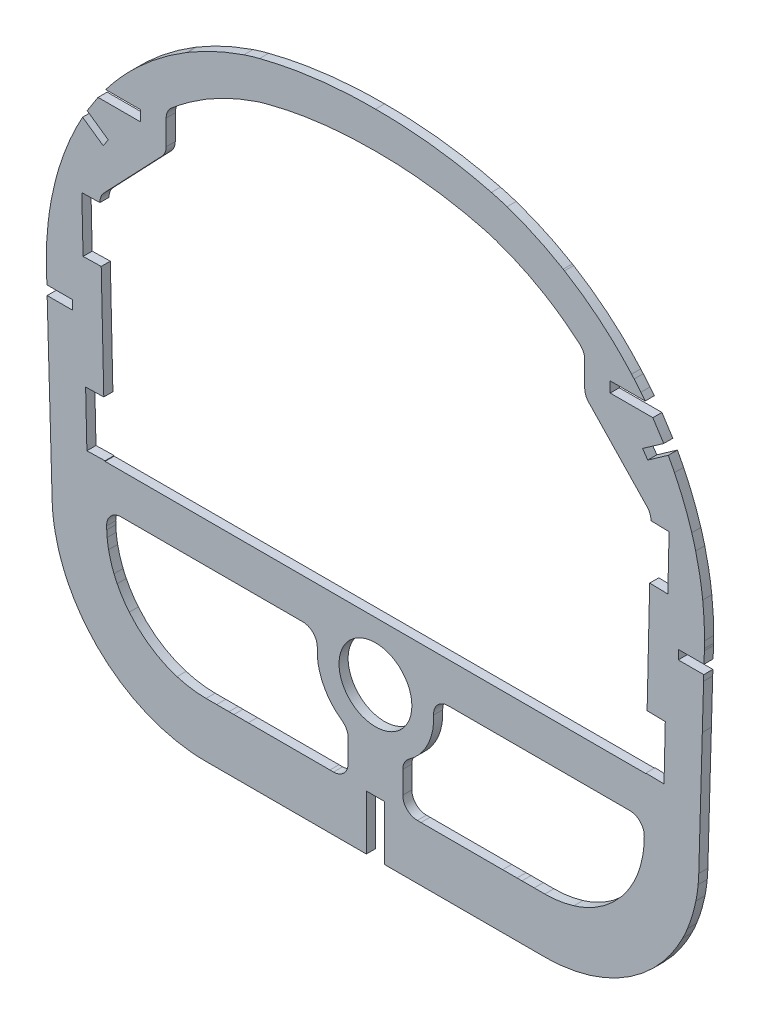
from build123d import *

# Parameters (mm, degrees)
SKETCH1_R           = 12.7
BOSS_EXTRUDE1_DEPTH = 1.5875
SKETCH2_R           = 20.32
CUT_EXTRUDE1_DEPTH  = 169.343867969
BOSS_EXTRUDE2_START = -3.175
BOSS_EXTRUDE2_DEPTH = 3.175
CUT_EXTRUDE3_DEPTH  = 169.343867969
BOSS_EXTRUDE3_START = -3.175
BOSS_EXTRUDE3_DEPTH = 3.175
FILLET1_R           = 5.08
CUT_EXTRUDE4_DEPTH  = 169.343867969


with BuildPart() as part:
    # Sketch1 → Boss-Extrude1 (new, symmetric)
    with BuildSketch(Plane.XY):
        with BuildLine():
            Line((-114.745219701, 17.50268352), (-114.725941099, 16.831990649))
            add(Edge.make_bspline(
                [(-114.725941099, 16.831990649), (-114.63641059, 13.717126836), (-114.546920366, 10.602259401), (-114.457477776, 7.487385265)],
                knots=[0, 0, 0, 0, 1, 1, 1, 1], degree=3, weights=[1, 1, 1, 1]))
            add(Edge.make_bspline(
                [(-114.457477776, 7.487385265), (-114.307187971, 2.253479662), (-114.157008662, -2.980453957), (-114.006996858, -8.214429234)],
                knots=[0, 0, 0, 0, 1, 1, 1, 1], degree=3, weights=[1, 1, 1, 1]))
            add(Edge.make_bspline(
                [(-114.006996858, -8.214429234), (-113.594092008, -22.620853681), (-113.18138691, -37.027683807), (-112.768745153, -51.434848977)],
                knots=[0, 0, 0, 0, 1, 1, 1, 1], degree=3, weights=[1, 1, 1, 1]))
            ThreePointArc((-112.768745153, -51.434848977), (-112.688043339, -53.175933137), (-112.55087679, -54.913480884))
            ThreePointArc((-112.55087679, -54.913480884), (-112.227978646, -57.588783935), (-111.771284771, -60.244521183))
            add(Edge.make_bspline(
                [(-111.771284771, -60.244521183), (-111.107373315, -63.598835082), (-110.122064493, -66.88944897), (-108.833223909, -70.05665448)],
                knots=[0, 0, 0, 0, 1, 1, 1, 1], degree=3, weights=[1, 1, 1, 1]))
            ThreePointArc((-108.833223909, -70.05665448), (-108.013564938, -71.964354711), (-107.120761168, -73.838937979))
            add(Edge.make_bspline(
                [(-107.120761168, -73.838937979), (-105.328832545, -77.42121555), (-103.134418824, -80.802035178), (-100.591921024, -83.897282027)],
                knots=[0, 0, 0, 0, 1, 1, 1, 1], degree=3, weights=[1, 1, 1, 1]))
            add(Edge.make_bspline(
                [(-100.591921024, -83.897282027), (-95.592425272, -89.983687859), (-89.401020105, -95.094032548), (-82.316654238, -98.869984949), (-74.78459325, -101.171976909)],
                knots=[0, 0, 0, 0, 0, 1, 1, 1, 1, 1], degree=4, weights=[1, 1, 1, 1, 1]))
            add(Edge.make_bspline(
                [(-74.78459325, -101.171976909), (-69.703753143, -102.724812597), (-64.391583826, -103.518123272), (-59.078900914, -103.51750007)],
                knots=[0, 0, 0, 0, 1, 1, 1, 1], degree=3, weights=[1, 1, 1, 1]))
            add(Edge.make_bspline(
                [(-59.078900914, -103.51750007), (-57.846433259, -103.517355498), (-56.613975306, -103.517238266), (-55.381524485, -103.517145846)],
                knots=[0, 0, 0, 0, 1, 1, 1, 1], degree=3, weights=[1, 1, 1, 1]))
            add(Edge.make_bspline(
                [(-55.381524485, -103.517145846), (-53.957166715, -103.517039039), (-52.532819232, -103.516967998), (-51.108477772, -103.516935673)],
                knots=[0, 0, 0, 0, 1, 1, 1, 1], degree=3, weights=[1, 1, 1, 1]))
            Line((-51.108477772, -103.516935673), (-49.378600467, -103.516915467))
            add(Edge.make_bspline(
                [(-49.378600467, -103.516915467), (-47.710160695, -103.51691463), (-46.041727647, -103.516961831), (-44.373293701, -103.517077629)],
                knots=[0, 0, 0, 0, 1, 1, 1, 1], degree=3, weights=[1, 1, 1, 1]))
            add(Edge.make_bspline(
                [(-44.373293701, -103.517077629), (-29.582422277, -103.51810416), (-14.791380965, -103.519626445), (-2e-09, -103.521672386)],
                knots=[0, 0, 0, 0, 1, 1, 1, 1], degree=3, weights=[1, 1, 1, 1]))
            add(Edge.make_bspline(
                [(44.373293701, -103.517077629), (29.582422277, -103.51810416), (14.791380965, -103.519626445), (-2e-09, -103.521672386)],
                knots=[0, 0, 0, 0, 1, 1, 1, 1], degree=3, weights=[1, 1, 1, 1]))
            add(Edge.make_bspline(
                [(49.378600467, -103.516915467), (47.710160695, -103.51691463), (46.041727647, -103.516961831), (44.373293701, -103.517077629)],
                knots=[0, 0, 0, 0, 1, 1, 1, 1], degree=3, weights=[1, 1, 1, 1]))
            Line((49.378600467, -103.516915467), (51.108477772, -103.516935673))
            add(Edge.make_bspline(
                [(55.381524485, -103.517145846), (53.957166715, -103.517039039), (52.532819232, -103.516967998), (51.108477772, -103.516935673)],
                knots=[0, 0, 0, 0, 1, 1, 1, 1], degree=3, weights=[1, 1, 1, 1]))
            add(Edge.make_bspline(
                [(59.078900914, -103.51750007), (57.846433259, -103.517355498), (56.613975306, -103.517238266), (55.381524485, -103.517145846)],
                knots=[0, 0, 0, 0, 1, 1, 1, 1], degree=3, weights=[1, 1, 1, 1]))
            add(Edge.make_bspline(
                [(74.78459325, -101.171976909), (69.703753143, -102.724812597), (64.391583826, -103.518123272), (59.078900914, -103.51750007)],
                knots=[0, 0, 0, 0, 1, 1, 1, 1], degree=3, weights=[1, 1, 1, 1]))
            add(Edge.make_bspline(
                [(100.591921024, -83.897282027), (95.592425272, -89.983687859), (89.401020105, -95.094032548), (82.316654238, -98.869984949), (74.78459325, -101.171976909)],
                knots=[0, 0, 0, 0, 0, 1, 1, 1, 1, 1], degree=4, weights=[1, 1, 1, 1, 1]))
            add(Edge.make_bspline(
                [(107.120761168, -73.838937979), (105.328832545, -77.42121555), (103.134418824, -80.802035178), (100.591921024, -83.897282027)],
                knots=[0, 0, 0, 0, 1, 1, 1, 1], degree=3, weights=[1, 1, 1, 1]))
            ThreePointArc((107.120761168, -73.838937979), (108.013564938, -71.964354711), (108.833223909, -70.05665448))
            add(Edge.make_bspline(
                [(111.771284771, -60.244521183), (111.107373315, -63.598835082), (110.122064493, -66.88944897), (108.833223909, -70.05665448)],
                knots=[0, 0, 0, 0, 1, 1, 1, 1], degree=3, weights=[1, 1, 1, 1]))
            ThreePointArc((111.771284771, -60.244521183), (112.227978646, -57.588783935), (112.55087679, -54.913480884))
            ThreePointArc((112.55087679, -54.913480884), (112.688043339, -53.175933137), (112.768745153, -51.434848977))
            add(Edge.make_bspline(
                [(114.006996858, -8.214429234), (113.594092008, -22.620853681), (113.18138691, -37.027683807), (112.768745153, -51.434848977)],
                knots=[0, 0, 0, 0, 1, 1, 1, 1], degree=3, weights=[1, 1, 1, 1]))
            add(Edge.make_bspline(
                [(114.457477776, 7.487385265), (114.307187971, 2.253479662), (114.157008662, -2.980453957), (114.006996858, -8.214429234)],
                knots=[0, 0, 0, 0, 1, 1, 1, 1], degree=3, weights=[1, 1, 1, 1]))
            add(Edge.make_bspline(
                [(114.725941099, 16.831990649), (114.63641059, 13.717126836), (114.546920366, 10.602259401), (114.457477776, 7.487385265)],
                knots=[0, 0, 0, 0, 1, 1, 1, 1], degree=3, weights=[1, 1, 1, 1]))
            Line((114.725941099, 16.831990649), (114.745219701, 17.50268352))
            add(Edge.make_bspline(
                [(114.789005912, 19.863219177), (114.783578069, 19.076239432), (114.767832082, 18.289356898), (114.745219701, 17.50268352)],
                knots=[0, 0, 0, 0, 0.999949851, 0.999949851, 0.999949851, 0.999949851], degree=3, weights=[1, 1, 1, 1]))
            add(Edge.make_bspline(
                [(114.158943276, 31.865695052), (114.606138459, 27.882027972), (114.816653441, 23.871808144), (114.789005912, 19.863219177)],
                knots=[0, 0, 0, 0, 1, 1, 1, 1], degree=3, weights=[1, 1, 1, 1]))
            add(Edge.make_bspline(
                [(111.684573503, 45.461033638), (112.817340494, 40.992572367), (113.644690454, 36.446719505), (114.158943276, 31.865695052)],
                knots=[0, 0, 0, 0, 1, 1, 1, 1], degree=3, weights=[1, 1, 1, 1]))
            ThreePointArc((111.684573503, 45.461033638), (111.039061352, 47.881394375), (110.333919599, 50.28505973))
            add(Edge.make_bspline(
                [(104.306410252, 65.447751106), (106.718862852, 60.566499961), (108.736743892, 55.490368749), (110.333919599, 50.28505973)],
                knots=[0, 0, 0, 0, 1, 1, 1, 1], degree=3, weights=[1, 1, 1, 1]))
            add(Edge.make_bspline(
                [(92.591503427, 83.848852612), (97.14327095, 78.160171497), (101.078545041, 71.978872592), (104.306410252, 65.447751106)],
                knots=[0.000155167, 0.000155167, 0.000155167, 0.000155167, 1, 1, 1, 1], degree=3, weights=[1, 1, 1, 1]))
            ThreePointArc((92.591503427, 83.848852612), (91.425078169, 85.279695716), (90.232771029, 86.689044343))
            ThreePointArc((90.232771029, 86.689044343), (89.792232132, 87.196837869), (89.348332197, 87.701695902))
            add(Edge.make_bspline(
                [(65.944329998, 107.226814859), (74.668891481, 101.945417302), (82.588941753, 95.338030018), (89.348332197, 87.701695902)],
                knots=[0, 0, 0, 0, 1, 1, 1, 1], degree=3, weights=[1, 1, 1, 1]))
            Line((65.944329998, 107.226814859), (65.496240856, 107.496486164))
            add(Edge.make_bspline(
                [(45.895792553, 116.544518586), (52.726322536, 114.237124464), (59.30942518, 111.198133381), (65.496240856, 107.496486164)],
                knots=[0, 0, 0, 0, 1, 1, 1, 1], degree=3, weights=[1, 1, 1, 1]))
            ThreePointArc((45.895792553, 116.544518586), (43.177996547, 117.403166162), (40.428399029, 118.153768767))
            add(Edge.make_bspline(
                [(40.428399029, 118.153768767), (39.338061837, 118.428387587), (37.157463208, 118.977606147), (33.856301535, 119.70948989), (30.535885824, 120.37426224), (27.195829245, 120.965490945), (23.83863112, 121.485095365), (20.46591669, 121.932693658), (17.079460249, 122.308500946), (13.680927413, 122.612357423), (10.271955071, 122.844687918), (6.854161077, 123.003605665), (3.429096592, 123.095526457), (1.143477199, 123.095526457), (-2e-09, 123.095526457)],
                knots=[0, 0, 0, 0, 0.083199823, 0.166393866, 0.249589221, 0.33279405, 0.416017442, 0.499269274, 0.582560092, 0.665900987, 0.749303484, 0.832779429, 0.916340878, 1, 1, 1, 1], degree=3))
            add(Edge.make_bspline(
                [(-40.428399029, 118.153768767), (-39.338061838, 118.428387587), (-37.157463209, 118.977606147), (-33.856301535, 119.70948989), (-30.535885825, 120.374262239), (-27.195829246, 120.965490945), (-23.838631121, 121.485095365), (-20.465916692, 121.932693658), (-17.079460251, 122.308500946), (-13.680927416, 122.612357423), (-10.271955073, 122.844687918), (-6.854161079, 123.003605665), (-3.429096594, 123.095526457), (-1.143477203, 123.095526457), (-2e-09, 123.095526457)],
                knots=[0, 0, 0, 0, 0.083199823, 0.166393866, 0.249589221, 0.33279405, 0.416017442, 0.499269274, 0.582560092, 0.665900987, 0.749303484, 0.832779429, 0.916340878, 1, 1, 1, 1], degree=3))
            ThreePointArc((-40.428399029, 118.153768767), (-43.177996547, 117.403166162), (-45.895792553, 116.544518586))
            add(Edge.make_bspline(
                [(-45.895792553, 116.544518586), (-52.726322536, 114.237124464), (-59.30942518, 111.198133381), (-65.496240856, 107.496486164)],
                knots=[0, 0, 0, 0, 1, 1, 1, 1], degree=3, weights=[1, 1, 1, 1]))
            Line((-65.496240856, 107.496486164), (-65.944329998, 107.226814859))
            add(Edge.make_bspline(
                [(-65.944329998, 107.226814859), (-74.668891481, 101.945417302), (-82.588941753, 95.338030018), (-89.348332197, 87.701695902)],
                knots=[0, 0, 0, 0, 1, 1, 1, 1], degree=3, weights=[1, 1, 1, 1]))
            ThreePointArc((-89.348332197, 87.701695902), (-89.792232132, 87.196837869), (-90.232771029, 86.689044343))
            ThreePointArc((-90.232771029, 86.689044343), (-91.425078169, 85.279695716), (-92.591503427, 83.848852612))
            add(Edge.make_bspline(
                [(-92.591503427, 83.848852612), (-97.14327095, 78.160171497), (-101.078545041, 71.978872592), (-104.306410252, 65.447751106)],
                knots=[0.000155167, 0.000155167, 0.000155167, 0.000155167, 1, 1, 1, 1], degree=3, weights=[1, 1, 1, 1]))
            add(Edge.make_bspline(
                [(-104.306410252, 65.447751106), (-106.718862852, 60.566499961), (-108.736743892, 55.490368749), (-110.333919599, 50.28505973)],
                knots=[0, 0, 0, 0, 1, 1, 1, 1], degree=3, weights=[1, 1, 1, 1]))
            ThreePointArc((-110.333919599, 50.28505973), (-111.039061352, 47.881394375), (-111.684573503, 45.461033638))
            add(Edge.make_bspline(
                [(-111.684573503, 45.461033638), (-112.817340494, 40.992572367), (-113.644690454, 36.446719505), (-114.158943276, 31.865695052)],
                knots=[0, 0, 0, 0, 1, 1, 1, 1], degree=3, weights=[1, 1, 1, 1]))
            add(Edge.make_bspline(
                [(-114.158943276, 31.865695052), (-114.606138459, 27.882027972), (-114.816653441, 23.871808144), (-114.789005912, 19.863219177)],
                knots=[0, 0, 0, 0, 1, 1, 1, 1], degree=3, weights=[1, 1, 1, 1]))
            add(Edge.make_bspline(
                [(-114.789005912, 19.863219177), (-114.783578069, 19.076239432), (-114.767832082, 18.289356898), (-114.745219701, 17.50268352)],
                knots=[0, 0, 0, 0, 0.999949851, 0.999949851, 0.999949851, 0.999949851], degree=3, weights=[1, 1, 1, 1]))
        make_face()
        with Locations((0, -50.8)):
            Circle(SKETCH1_R, mode=Mode.SUBTRACT)
    extrude(amount=BOSS_EXTRUDE1_DEPTH, both=True)

    # Sketch2 → Cut-Extrude1 (cut, through all)
    with BuildSketch(Plane.XY.offset(1.5875)):
        with BuildLine():
            Line((-102.050463045, 17.867585499), (-102.031184204, 17.196884294))
            add(Edge.make_bspline(
                [(-102.031184204, 17.196884294), (-102.008800746, 16.418139435), (-101.96403891, 14.860650808), (-101.896911773, 12.524410001), (-101.829801051, 10.188164784), (-101.785071893, 8.630662089), (-101.762710321, 7.85191135)],
                knots=[-8.91e-07, -8.91e-07, -8.91e-07, -8.91e-07, 0.249999332, 0.499999554, 0.749999777, 1, 1, 1, 1], degree=3))
            add(Edge.make_bspline(
                [(-101.762710321, 7.85191135), (-101.725136444, 6.543385291), (-101.650002801, 3.92634007), (-101.537348227, 0.000729396), (-101.424745489, -3.924904493), (-101.349714688, -6.54202509), (-101.312209931, -7.850581912)],
                knots=[0, 0, 0, 0, 0.25, 0.5, 0.75, 1, 1, 1, 1], degree=3))
            add(Edge.make_bspline(
                [(-101.312209931, -7.850581912), (-101.209005728, -11.451420096), (-101.002624636, -18.65306494), (-100.693113652, -29.455727912), (-100.383653292, -40.258483963), (-100.177369952, -47.460437031), (-100.074233248, -51.061399329)],
                knots=[0, 0, 0, 0, 0.249943011, 0.499886022, 0.749829033, 0.999772044, 0.999772044, 0.999772044, 0.999772044], degree=3))
            ThreePointArc((-100.074233248, -51.061399329), (-100.012611827, -52.386338416), (-99.908161909, -53.708590659))
            ThreePointArc((-99.908161909, -53.708590659), (-99.661632916, -55.751134621), (-99.312957114, -57.778740984))
            add(Edge.make_bspline(
                [(-99.312957114, -57.778740984), (-99.186298208, -58.418660842), (-98.902364609, -59.692255532), (-98.385225857, -61.582274016), (-97.778532025, -63.445475331), (-97.315789282, -64.665524335), (-97.069912529, -65.269744686)],
                knots=[8.435e-06, 8.435e-06, 8.435e-06, 8.435e-06, 0.250005448, 0.500002461, 0.749999475, 0.999996488, 0.999996488, 0.999996488, 0.999996488], degree=3))
            ThreePointArc((-97.069912529, -65.269744686), (-96.444138483, -66.726189812), (-95.762522673, -68.157352083))
            add(Edge.make_bspline(
                [(-95.762522673, -68.157352083), (-95.420721884, -68.840650935), (-94.698870817, -70.187794284), (-93.503074088, -72.147852648), (-92.199695974, -74.038052913), (-91.263189017, -75.245782616), (-90.778256541, -75.836141324)],
                knots=[3.677e-06, 3.677e-06, 3.677e-06, 3.677e-06, 0.250002758, 0.500001839, 0.750000919, 1, 1, 1, 1], degree=3))
            add(Edge.make_bspline(
                [(-90.778256541, -75.836141324), (-89.5068667, -77.383936328), (-86.732462047, -80.297419908), (-81.98109245, -84.008900731), (-76.738822768, -86.986824087), (-72.988073791, -88.441143727), (-71.07263786, -89.026550314)],
                knots=[0, 0, 0, 0, 0.25, 0.5, 0.75, 1, 1, 1, 1], degree=3))
            add(Edge.make_bspline(
                [(-71.07263786, -89.026550314), (-70.103821767, -89.322645482), (-68.144734069, -89.842285315), (-65.148404864, -90.403750907), (-62.118788467, -90.742207047), (-60.093419884, -90.817618991), (-59.080390681, -90.817500158)],
                knots=[0, 0, 0, 0, 0.25, 0.5, 0.75, 1, 1, 1, 1], degree=3))
            add(Edge.make_bspline(
                [(-59.080390681, -90.817500158), (-58.772227934, -90.817464009), (-58.155900801, -90.81739513), (-57.231420128, -90.817301829), (-56.306944263, -90.817218308), (-55.690633155, -90.81716899), (-55.382476834, -90.817145882)],
                knots=[0, 0, 0, 0, 0.25, 0.5, 0.75, 1, 1, 1, 1], degree=3))
            add(Edge.make_bspline(
                [(-55.382476834, -90.817145882), (-55.026328468, -90.817119176), (-54.314031712, -90.817070235), (-53.24558692, -90.817010514), (-52.17714195, -90.816964762), (-51.46484463, -90.816943757), (-51.108696054, -90.816935675)],
                knots=[0, 0, 0, 0, 0.250004092, 0.500008184, 0.750012275, 1.000016367, 1.000016367, 1.000016367, 1.000016367], degree=3))
            Line((-51.108696054, -90.816935675), (-49.378677826, -90.816915467))
            add(Edge.make_bspline(
                [(-49.378677826, -90.816915467), (-48.961498146, -90.816915257), (-48.127143203, -90.816920843), (-46.875584291, -90.816949169), (-45.624011532, -90.816999369), (-44.789610407, -90.817048704), (-44.372412255, -90.81707766)],
                knots=[-1.4182e-05, -1.4182e-05, -1.4182e-05, -1.4182e-05, 0.249989363, 0.499992909, 0.749996454, 1, 1, 1, 1], degree=3))
            add(Edge.make_bspline(
                [(-44.372412255, -90.81707766), (-40.674757865, -90.817334288), (-33.581755225, -90.817885995), (-24.639838712, -90.818727254), (-17.244432866, -90.819513267), (-9.546700394, -90.820403554), (-3.697752931, -90.821160802), (0, -90.821672264)],
                knots=[0, 0, 0, 0, 0.249990103, 0.479543267, 0.604538319, 0.74997031, 0.999960413, 0.999960413, 0.999960413, 0.999960413], degree=3))
            add(Edge.make_bspline(
                [(0, -90.821672264), (3.697752931, -90.821160802), (9.546700394, -90.820403554), (17.244432866, -90.819513267), (24.639838712, -90.818727254), (33.581755225, -90.817885995), (40.674757865, -90.817334288), (44.372412284, -90.81707766)],
                knots=[3.9587e-05, 3.9587e-05, 3.9587e-05, 3.9587e-05, 0.25002969, 0.395461681, 0.520456733, 0.750009897, 1, 1, 1, 1], degree=3))
            add(Edge.make_bspline(
                [(44.372412284, -90.81707766), (44.789610407, -90.817048704), (45.624011532, -90.816999369), (46.87558429, -90.816949169), (48.127143202, -90.816920843), (48.961498145, -90.816915257), (49.378677825, -90.816915467)],
                knots=[0, 0, 0, 0, 0.250003546, 0.500007091, 0.750010637, 1.000014182, 1.000014182, 1.000014182, 1.000014182], degree=3))
            Line((49.378677825, -90.816915467), (51.108696054, -90.816935675))
            add(Edge.make_bspline(
                [(51.108696054, -90.816935675), (51.46484463, -90.816943757), (52.17714195, -90.816964762), (53.24558692, -90.817010514), (54.314031712, -90.817070235), (55.026328468, -90.817119176), (55.382476817, -90.817145882)],
                knots=[-1.6367e-05, -1.6367e-05, -1.6367e-05, -1.6367e-05, 0.249987725, 0.499991816, 0.749995908, 1, 1, 1, 1], degree=3))
            add(Edge.make_bspline(
                [(55.382476817, -90.817145882), (55.690633155, -90.81716899), (56.306944263, -90.817218308), (57.231420128, -90.817301829), (58.155900801, -90.81739513), (58.772227934, -90.817464009), (59.080390665, -90.817500158)],
                knots=[0, 0, 0, 0, 0.25, 0.5, 0.75, 1, 1, 1, 1], degree=3))
            add(Edge.make_bspline(
                [(59.080390665, -90.817500158), (60.093419884, -90.817618991), (62.118788467, -90.742207047), (65.148404864, -90.403750907), (68.144734069, -89.842285315), (70.103821767, -89.322645482), (71.072637852, -89.026550316)],
                knots=[0, 0, 0, 0, 0.25, 0.5, 0.75, 1, 1, 1, 1], degree=3))
            add(Edge.make_bspline(
                [(71.072637852, -89.026550316), (72.988073791, -88.441143727), (76.738822768, -86.986824087), (81.98109245, -84.008900731), (86.732462047, -80.297419908), (89.5068667, -77.383936328), (90.778256549, -75.836141315)],
                knots=[0, 0, 0, 0, 0.25, 0.5, 0.75, 1, 1, 1, 1], degree=3))
            add(Edge.make_bspline(
                [(90.778256549, -75.836141315), (91.263189017, -75.245782616), (92.199695973, -74.038052914), (93.503074088, -72.147852649), (94.698870816, -70.187794286), (95.420721883, -68.840650937), (95.762522672, -68.157352085)],
                knots=[0, 0, 0, 0, 0.249999081, 0.499998161, 0.749997242, 0.999996323, 0.999996323, 0.999996323, 0.999996323], degree=3))
            ThreePointArc((95.762522672, -68.157352085), (96.444138483, -66.726189813), (97.069912528, -65.269744687))
            add(Edge.make_bspline(
                [(97.069912528, -65.269744687), (97.315789266, -64.665524375), (97.778531982, -63.445475449), (98.385225784, -61.582274255), (98.902364517, -59.692255895), (99.186298111, -58.418661289), (99.312957017, -57.778741474)],
                knots=[3.512e-06, 3.512e-06, 3.512e-06, 3.512e-06, 0.250000509, 0.499997507, 0.749994504, 0.999991501, 0.999991501, 0.999991501, 0.999991501], degree=3))
            ThreePointArc((99.312957017, -57.778741474), (99.661632939, -55.751134468), (99.908161986, -53.708589855))
            ThreePointArc((99.908161986, -53.708589855), (100.012611852, -52.386338014), (100.074233248, -51.061399334))
            add(Edge.make_bspline(
                [(100.074233248, -51.061399334), (100.177369952, -47.460437035), (100.383653292, -40.258483966), (100.693113652, -29.455727914), (101.002624636, -18.653064941), (101.209005728, -11.451420096), (101.312209932, -7.850581901)],
                knots=[0.000227956, 0.000227956, 0.000227956, 0.000227956, 0.250170967, 0.500113978, 0.750056989, 1, 1, 1, 1], degree=3))
            add(Edge.make_bspline(
                [(101.312209932, -7.850581901), (101.349714688, -6.54202509), (101.424745489, -3.924904493), (101.537348227, 0.000729396), (101.650002801, 3.92634007), (101.725136444, 6.543385291), (101.762710316, 7.851911159)],
                knots=[0, 0, 0, 0, 0.25, 0.5, 0.75, 1, 1, 1, 1], degree=3))
            add(Edge.make_bspline(
                [(101.762710316, 7.851911159), (101.785071893, 8.630662089), (101.829801051, 10.188164784), (101.896911773, 12.524410001), (101.96403891, 14.860650808), (102.008800746, 16.418139435), (102.031184204, 17.196884294)],
                knots=[0, 0, 0, 0, 0.250000223, 0.500000446, 0.750000668, 1.000000891, 1.000000891, 1.000000891, 1.000000891], degree=3))
            Line((102.031184204, 17.196884294), (102.050463045, 17.867585499))
            add(Edge.make_bspline(
                [(102.050463045, 17.867585499), (102.055551985, 18.044627171), (102.065000889, 18.400471802), (102.076319054, 18.92387062), (102.084692043, 19.442100282), (102.08813442, 19.780657865), (102.089307966, 19.950809687)],
                knots=[0, 0, 0, 0, 0.249987463, 0.499974925, 0.749962388, 0.999949851, 0.999949851, 0.999949851, 0.999949851], degree=3))
            add(Edge.make_bspline(
                [(102.089307966, 19.950809687), (102.095352924, 20.827262326), (102.081407299, 22.580361419), (101.982484379, 25.208721183), (101.805673274, 27.832993935), (101.63599196, 29.577923303), (101.538215451, 30.448927892)],
                knots=[0, 0, 0, 0, 0.25, 0.5, 0.75, 1, 1, 1, 1], degree=3))
            add(Edge.make_bspline(
                [(101.538215451, 30.448927892), (101.425780929, 31.450507804), (101.166683011, 33.449848276), (100.675866954, 36.43458947), (100.083590763, 39.400865014), (99.621642689, 41.363287328), (99.3739787, 42.340255594)],
                knots=[0, 0, 0, 0, 0.249999819, 0.499999638, 0.749999457, 0.999999276, 0.999999276, 0.999999276, 0.999999276], degree=3))
            ThreePointArc((99.3739787, 42.340255594), (98.809370853, 44.457263785), (98.192607267, 46.559669165))
            add(Edge.make_bspline(
                [(98.192607267, 46.559669165), (97.843455662, 47.697579033), (97.09915666, 49.959324861), (95.846474919, 53.305339769), (94.460053728, 56.598199577), (93.448399334, 58.753696156), (92.92102149, 59.820769434)],
                knots=[0, 0, 0, 0, 0.25, 0.5, 0.75, 1, 1, 1, 1], degree=3))
            add(Edge.make_bspline(
                [(92.92102149, 59.820769434), (92.215488033, 61.248315016), (90.727075847, 64.065261788), (88.268474703, 68.166816093), (85.592637852, 72.130142819), (83.670079885, 74.670937426), (82.675169091, 75.914351158)],
                knots=[0.000155167, 0.000155167, 0.000155167, 0.000155167, 0.250116375, 0.500077583, 0.750038792, 1, 1, 1, 1], degree=3))
            ThreePointArc((82.675169091, 75.914351158), (81.654988464, 77.165797322), (80.612170986, 78.398443954))
            ThreePointArc((80.612170986, 78.398443954), (80.226876255, 78.842559395), (79.838642069, 79.284107549))
            add(Edge.make_bspline(
                [(79.838642069, 79.284107549), (78.362419756, 80.951849938), (75.283114527, 84.175306143), (70.307385835, 88.654691825), (65.009320695, 92.747909143), (61.286332205, 95.200376706), (59.381113559, 96.354166732)],
                knots=[7.02e-07, 7.02e-07, 7.02e-07, 7.02e-07, 0.249852353, 0.499704004, 0.749555655, 0.999407305, 0.999407305, 0.999407305, 0.999407305], degree=3))
            Line((59.381113559, 96.354166732), (58.962072488, 96.606356177))
            add(Edge.make_bspline(
                [(58.962072488, 96.606356177), (57.610588797, 97.414635861), (54.864304481, 98.958940802), (50.624898817, 101.054047276), (46.280089057, 102.920712934), (43.323193752, 104.008511486), (41.831298443, 104.512482697)],
                knots=[0.00083826, 0.00083826, 0.00083826, 0.00083826, 0.250628695, 0.50041913, 0.750209565, 1, 1, 1, 1], degree=3))
            ThreePointArc((41.831298443, 104.512482697), (39.592036826, 105.219944385), (37.326573127, 105.838385051))
            add(Edge.make_bspline(
                [(37.326573127, 105.838385051), (36.925308566, 105.939449933), (36.111199889, 106.144473374), (34.958304093, 106.429835119), (33.856064431, 106.69300558), (32.369380378, 107.031146808), (30.456228314, 107.439396781), (27.402681229, 108.041668497), (23.559199224, 108.699588843), (18.906303056, 109.342056946), (14.223403122, 109.835150565), (10.305878355, 110.122476445), (7.161744759, 110.276550314), (5.181542218, 110.344309972), (3.631808636, 110.37767877), (2.476199978, 110.39092952), (1.268752358, 110.395506859), (0.4192021, 110.395526457), (-1e-09, 110.395526457)],
                knots=[0, 0, 0, 0, 0.03125, 0.0625, 0.09375, 0.125, 0.1875, 0.25, 0.375, 0.5, 0.625, 0.75, 0.8125, 0.875, 0.90625, 0.9375, 0.96875, 1, 1, 1, 1], degree=3))
            add(Edge.make_bspline(
                [(-1e-09, 110.395526457), (-0.419202103, 110.395526457), (-1.268752361, 110.395506859), (-2.476199981, 110.39092952), (-3.631808639, 110.37767877), (-5.181542221, 110.344309972), (-7.161744762, 110.276550314), (-10.305878357, 110.122476445), (-14.223403124, 109.835150565), (-18.906303058, 109.342056946), (-23.559199225, 108.699588843), (-27.402681229, 108.041668497), (-30.456228315, 107.439396781), (-32.369380378, 107.031146808), (-33.856064432, 106.69300558), (-34.958304093, 106.429835119), (-36.111199889, 106.144473374), (-36.925308566, 105.939449934), (-37.326573127, 105.838385051)],
                knots=[0, 0, 0, 0, 0.03125, 0.0625, 0.09375, 0.125, 0.1875, 0.25, 0.375, 0.5, 0.625, 0.75, 0.8125, 0.875, 0.90625, 0.9375, 0.96875, 1, 1, 1, 1], degree=3))
            ThreePointArc((-37.326573127, 105.838385051), (-39.592036826, 105.219944385), (-41.831298443, 104.512482697))
            add(Edge.make_bspline(
                [(-41.831298443, 104.512482697), (-43.323193752, 104.008511486), (-46.280089057, 102.920712934), (-50.624898817, 101.054047276), (-54.864304481, 98.958940803), (-57.610588797, 97.414635861), (-58.962072488, 96.606356177)],
                knots=[0, 0, 0, 0, 0.249790435, 0.49958087, 0.749371305, 0.99916174, 0.99916174, 0.99916174, 0.99916174], degree=3))
            Line((-58.962072488, 96.606356177), (-59.381113559, 96.354166732))
            add(Edge.make_bspline(
                [(-59.381113559, 96.354166732), (-61.286332205, 95.200376706), (-65.009320695, 92.747909143), (-70.307385835, 88.654691825), (-75.283114527, 84.175306143), (-78.362419756, 80.951849938), (-79.838642069, 79.284107549)],
                knots=[0.000592695, 0.000592695, 0.000592695, 0.000592695, 0.250444345, 0.500295996, 0.750147647, 0.999999298, 0.999999298, 0.999999298, 0.999999298], degree=3))
            ThreePointArc((-79.838642069, 79.284107549), (-80.22687631, 78.842559444), (-80.612171028, 78.39844399))
            ThreePointArc((-80.612171028, 78.39844399), (-81.654988506, 77.165797357), (-82.675169091, 75.914351158))
            add(Edge.make_bspline(
                [(-82.675169091, 75.914351158), (-83.670079885, 74.670937426), (-85.592637852, 72.130142819), (-88.268474703, 68.166816093), (-90.727075847, 64.065261788), (-92.215488033, 61.248315016), (-92.921021454, 59.820769507)],
                knots=[0.000155167, 0.000155167, 0.000155167, 0.000155167, 0.250116375, 0.500077583, 0.750038792, 1, 1, 1, 1], degree=3))
            add(Edge.make_bspline(
                [(-92.921021454, 59.820769507), (-93.448399334, 58.753696156), (-94.460053728, 56.598199577), (-95.846474919, 53.305339769), (-97.09915666, 49.959324861), (-97.843455662, 47.697579033), (-98.192607267, 46.559669165)],
                knots=[0, 0, 0, 0, 0.25, 0.5, 0.75, 1, 1, 1, 1], degree=3))
            ThreePointArc((-98.192607267, 46.559669165), (-98.809370853, 44.457263785), (-99.3739787, 42.340255594))
            add(Edge.make_bspline(
                [(-99.3739787, 42.340255594), (-99.621642689, 41.363287328), (-100.083590763, 39.400865014), (-100.675866954, 36.43458947), (-101.166683011, 33.449848276), (-101.425780929, 31.450507804), (-101.538215449, 30.448927916)],
                knots=[7.24e-07, 7.24e-07, 7.24e-07, 7.24e-07, 0.250000543, 0.500000362, 0.750000181, 1, 1, 1, 1], degree=3))
            add(Edge.make_bspline(
                [(-101.538215449, 30.448927916), (-101.63599196, 29.577923303), (-101.805673274, 27.832993935), (-101.982484379, 25.208721183), (-102.081407299, 22.580361419), (-102.095352924, 20.827262326), (-102.089307968, 19.950809918)],
                knots=[0, 0, 0, 0, 0.25, 0.5, 0.75, 1, 1, 1, 1], degree=3))
            add(Edge.make_bspline(
                [(-102.089307968, 19.950809918), (-102.08813442, 19.780657865), (-102.084692043, 19.442100282), (-102.076319054, 18.92387062), (-102.065000889, 18.400471802), (-102.055551985, 18.044627171), (-102.050463045, 17.867585499)],
                knots=[0, 0, 0, 0, 0.249987463, 0.499974925, 0.749962388, 0.999949851, 0.999949851, 0.999949851, 0.999949851], degree=3))
        make_face()
        with Locations((0, -50.8)):
            Circle(SKETCH2_R, mode=Mode.SUBTRACT)
    extrude(amount=-CUT_EXTRUDE1_DEPTH, mode=Mode.SUBTRACT)


with BuildPart() as cut_extrude1_piece_1:
    # of the separate pieces the step leaves, piece 1, a body of its own (cut_extrude1_pieces)
    add(part.part.solids().sort_by_distance((-110.333919599, 50.28505973, 0))[0])



with BuildPart() as cut_extrude1_piece_2:
    # of the separate pieces the step leaves, piece 2, a body of its own (cut_extrude1_pieces)
    add(part.part.solids().sort_by_distance((20.32, -50.8, -1.5875))[0])


with BuildPart() as cut_extrude1_piece_1_1:
    add(cut_extrude1_piece_1.part)

    add(cut_extrude1_piece_2.part)  # Boss-Extrude2 merges Cut-Extrude1 piece 2
    # Boss-Extrude2: read off the stored shape, not the designer's step
    # Boss-Extrude2 outline → Boss-Extrude2 (add)
    with BuildSketch(Plane.XY.offset(1.5875).offset(BOSS_EXTRUDE2_START)):
        with BuildLine():
            ThreePointArc((9.525, -68.749283412), (0, -71.12), (-9.525, -68.749283412))
            Line((-9.525, -68.749283412), (-9.525, -90.820426895))
            add(Edge.make_bspline(
                [(-9.525, -90.820426895), (-7.408338307, -90.820687682), (-5.291668853, -90.82095907), (-3.175, -90.821241139)],
                knots=[0.78531161, 0.78531161, 0.78531161, 0.78531161, 0.928410839, 0.928410839, 0.928410839, 0.928410839], degree=3))
            Line((-3.175, -90.821241139), (-3.175, -84.471241252))
            Line((-3.175, -84.471241252), (3.175, -84.471241252))
            Line((3.175, -84.471241252), (3.175, -90.821241139))
            add(Edge.make_bspline(
                [(3.175, -90.821241139), (5.291668853, -90.82095907), (7.408338307, -90.820687682), (9.525, -90.820426895)],
                knots=[0.071589161, 0.071589161, 0.071589161, 0.071589161, 0.21468839, 0.21468839, 0.21468839, 0.21468839], degree=3))
            Line((9.525, -90.820426895), (9.525, -68.749283412))
        make_face()
        with BuildLine():
            ThreePointArc((-98.192607267, 46.559669165), (-98.332455752, 46.099441412), (-98.469804562, 45.63846149))
            ThreePointArc((-98.469804562, 45.63846149), (-97.995517894, 46.743328518), (-97.274847349, 47.705780054))
            Line((-97.274847349, 47.705780054), (-72.996737232, 73.180852612))
            Line((-72.996737232, 73.180852612), (-72.996737232, 86.204774575))
            add(Edge.make_bspline(
                [(-72.996737232, 86.204774575), (-73.751072941, 85.521200538), (-76.119822502, 83.299429504), (-78.362419756, 80.951849938), (-79.838642069, 79.284107549)],
                knots=[0.636075241, 0.636075241, 0.636075241, 0.636075241, 0.750147647, 0.999999298, 0.999999298, 0.999999298, 0.999999298], degree=3))
            ThreePointArc((-79.838642069, 79.284107549), (-80.226876303, 78.842559438), (-80.612171035, 78.398443996))
            ThreePointArc((-80.612171035, 78.398443996), (-81.654988485, 77.165797339), (-82.675169113, 75.914351175))
            add(Edge.make_bspline(
                [(-82.675169113, 75.914351175), (-83.670079885, 74.670937426), (-85.592637852, 72.130142819), (-88.268474703, 68.166816093), (-90.727075847, 64.065261788), (-92.215488033, 61.248315016), (-92.921021454, 59.820769507)],
                knots=[0.000155167, 0.000155167, 0.000155167, 0.000155167, 0.250116375, 0.500077583, 0.750038792, 1, 1, 1, 1], degree=3))
            add(Edge.make_bspline(
                [(-92.921021454, 59.820769507), (-93.448399334, 58.753696156), (-94.460053728, 56.598199577), (-95.846474919, 53.305339769), (-97.09915666, 49.959324861), (-97.843455662, 47.697579033), (-98.192607267, 46.559669165)],
                knots=[0, 0, 0, 0, 0.25, 0.5, 0.75, 1, 1, 1, 1], degree=3))
        make_face()
        with BuildLine():
            add(Edge.make_bspline(
                [(-101.762710316, 7.851911159), (-101.725136444, 6.543385291), (-101.682124287, 5.045191454), (-101.639122156, 3.546988257), (-101.633678253, 3.357315705)],
                knots=[0, 0, 0, 0, 0.25, 0.286237667, 0.286237667, 0.286237667, 0.286237667], degree=3))
            Line((-101.633678253, 3.357315705), (-98.00599396, 6.985))
            Line((-98.00599396, 6.985), (-98.00599396, 15.24))
            Line((-98.00599396, 15.24), (-102.082433427, 19.316439467))
            add(Edge.make_bspline(
                [(-102.082433427, 19.316439467), (-102.080527299, 19.18604613), (-102.075409842, 18.881824923), (-102.065000889, 18.400471802), (-102.055551985, 18.044627171), (-102.050463045, 17.867585499)],
                knots=[0.310233473, 0.310233473, 0.310233473, 0.310233473, 0.499974925, 0.749962388, 0.999949851, 0.999949851, 0.999949851, 0.999949851], degree=3))
            Line((-102.050463045, 17.867585499), (-102.031184204, 17.196884294))
            add(Edge.make_bspline(
                [(-102.031184204, 17.196884294), (-102.008800746, 16.418139435), (-101.96403891, 14.860650808), (-101.896911773, 12.524410001), (-101.829801051, 10.188164784), (-101.785071893, 8.630662089), (-101.762710316, 7.851911159)],
                knots=[-8.91e-07, -8.91e-07, -8.91e-07, -8.91e-07, 0.249999332, 0.499999554, 0.749999777, 1, 1, 1, 1], degree=3))
        make_face()
        with BuildLine():
            Line((-100.445489659, -38.1), (-15.862294916, -38.1))
            ThreePointArc((-15.862294916, -38.1), (-8.798818102, -32.483799521), (0, -30.48))
            Line((0, -30.48), (-100.66377851, -30.48))
            add(Edge.make_bspline(
                [(-100.66377851, -30.48), (-100.591011779, -33.01999008), (-100.518249127, -35.559988511), (-100.445489659, -38.1)],
                knots=[0.523584305, 0.523584305, 0.523584305, 0.523584305, 0.699887915, 0.699887915, 0.699887915, 0.699887915], degree=3))
        make_face()
    boss_extrude2 = extrude(amount=BOSS_EXTRUDE2_DEPTH)

    # Sketch4<5> → Cut-Extrude3 (cut, through all)
    with BuildSketch(Plane.XY.offset(1.5875)):
        with BuildLine():
            Line((-105.62599396, 12.7), (-114.607199654, 12.7))
            add(Edge.make_bspline(
                [(-114.607199654, 12.7), (-114.576792634, 11.641667282), (-114.54639064, 10.583333989), (-114.51599396, 9.525)],
                knots=[0.442179659, 0.442179659, 0.442179659, 0.442179659, 0.78194778, 0.78194778, 0.78194778, 0.78194778], degree=3))
            Line((-114.51599396, 9.525), (-105.62599396, 9.525))
            Line((-105.62599396, 9.525), (-105.62599396, 12.7))
        make_face()
        with BuildLine():
            add(Edge.make_bspline(
                [(-3.175, -90.821241139), (-2.116666168, -90.821382174), (-1.058332486, -90.821525879), (0, -90.821672264)],
                knots=[0.928410839, 0.928410839, 0.928410839, 0.928410839, 0.999960413, 0.999960413, 0.999960413, 0.999960413], degree=3))
            Line((-3.175, -90.821241139), (-3.175, -103.521241252))
            add(Edge.make_bspline(
                [(-3.175, -103.521241252), (-2.116668365, -103.521382289), (-1.058335053, -103.521525997), (-2e-09, -103.521672386)],
                knots=[0.928449206, 0.928449206, 0.928449206, 0.928449206, 1, 1, 1, 1], degree=3))
            add(Edge.make_bspline(
                [(3.175, -103.521241252), (2.116668365, -103.521382289), (1.058335053, -103.521525997), (2e-09, -103.521672386)],
                knots=[0.928449206, 0.928449206, 0.928449206, 0.928449206, 1, 1, 1, 1], degree=3))
            Line((3.175, -103.521241252), (3.175, -90.821241139))
            add(Edge.make_bspline(
                [(0, -90.821672264), (1.058332475, -90.821525879), (2.116666146, -90.821382174), (3.175, -90.821241139)],
                knots=[3.9587e-05, 3.9587e-05, 3.9587e-05, 3.9587e-05, 0.07158916, 0.07158916, 0.07158916, 0.07158916], degree=3))
        make_face()
        with BuildLine():
            Line((-101.35947398, 70.97266775), (-94.077212306, 65.87357323))
            Line((-94.077212306, 65.87357323), (-93.166659713, 67.173977101))
            Line((-93.166659713, 67.173977101), (-100.555892336, 72.347973485))
            add(Edge.make_bspline(
                [(-100.555892336, 72.347973485), (-100.82734855, 71.891650567), (-101.09522083, 71.433196896), (-101.35947398, 70.97266775)],
                knots=[0.640626266, 0.640626266, 0.640626266, 0.640626266, 0.713496013, 0.713496013, 0.713496013, 0.713496013], degree=3))
        make_face()
        with BuildLine():
            Line((-94.987764899, 64.57316936), (-94.077212306, 65.87357323))
            Line((-94.077212306, 65.87357323), (-101.35947398, 70.97266775))
            add(Edge.make_bspline(
                [(-101.35947398, 70.97266775), (-101.624103211, 70.511483184), (-101.885103004, 70.048217232), (-102.142438013, 69.582925408)],
                knots=[0.713496013, 0.713496013, 0.713496013, 0.713496013, 0.786469467, 0.786469467, 0.786469467, 0.786469467], degree=3))
            Line((-102.142438013, 69.582925408), (-94.987764899, 64.57316936))
        make_face()
        with BuildLine():
            add(Edge.make_bspline(
                [(-94.078737232, 81.943852612), (-94.998331944, 80.736448836), (-95.890736, 79.508351849), (-96.755127465, 78.260852612)],
                knots=[0.110715646, 0.110715646, 0.110715646, 0.110715646, 0.319004362, 0.319004362, 0.319004362, 0.319004362], degree=3))
            Line((-96.755127465, 78.260852612), (-81.886737232, 78.260852612))
            Line((-81.886737232, 78.260852612), (-81.886737232, 81.943852612))
            Line((-81.886737232, 81.943852612), (-94.078737232, 81.943852612))
        make_face()
    cut_extrude3 = extrude(amount=-CUT_EXTRUDE3_DEPTH, mode=Mode.SUBTRACT)

    # Boss-Extrude3: read off the stored shape, not the designer's step
    # Boss-Extrude3 outline → Boss-Extrude3 (add)
    with BuildSketch(Plane.XY.offset(1.5875).offset(BOSS_EXTRUDE3_START)):
        with BuildLine():
            add(Edge.make_bspline(
                [(-49.378716503, -84.466915467), (-48.961502023, -84.466915257), (-48.12707903, -84.466920843), (-46.875408741, -84.466949171), (-45.623707649, -84.466999376), (-44.789214781, -84.467048716), (-44.371971532, -84.467077675)],
                knots=[-2.1272e-05, -2.1272e-05, -2.1272e-05, -2.1272e-05, 0.249984046, 0.499989364, 0.749994682, 1, 1, 1, 1], degree=3))
            Line((-49.378716503, -84.466915467), (-51.108805197, -84.466935675))
            add(Edge.make_bspline(
                [(-55.382952982, -84.4671459), (-55.026774882, -84.467119191), (-54.314419091, -84.467070246), (-53.24588294, -84.467010521), (-52.177345428, -84.466964765), (-51.464985109, -84.466943759), (-51.108805197, -84.466935675)],
                knots=[0, 0, 0, 0, 0.250006137, 0.500012274, 0.750018412, 1.000024549, 1.000024549, 1.000024549, 1.000024549], degree=3))
            add(Edge.make_bspline(
                [(-59.081135541, -84.467500201), (-58.772950061, -84.46746405), (-58.156577751, -84.467395166), (-57.232027383, -84.467301858), (-56.307484746, -84.467218331), (-55.691130915, -84.46716901), (-55.382952982, -84.4671459)],
                knots=[0, 0, 0, 0, 0.25, 0.5, 0.75, 1, 1, 1, 1], degree=3))
            add(Edge.make_bspline(
                [(-69.216660153, -82.95383702), (-68.398421159, -83.203911945), (-66.744824942, -83.642532568), (-64.209643591, -84.11772377), (-61.646252621, -84.403959118), (-59.936714024, -84.467600565), (-59.081135541, -84.467500201)],
                knots=[0, 0, 0, 0, 0.25, 0.5, 0.75, 1, 1, 1, 1], degree=3))
            add(Edge.make_bspline(
                [(-85.871424305, -71.805570967), (-84.796827513, -73.113789336), (-82.451757274, -75.57636488), (-78.436215428, -78.713020923), (-74.005822683, -81.229785546), (-70.835594846, -82.459048853), (-69.216660153, -82.95383702)],
                knots=[1e-09, 1e-09, 1e-09, 1e-09, 0.25, 0.5, 0.75, 1, 1, 1, 1], degree=3))
            add(Edge.make_bspline(
                [(-90.083403014, -65.316559957), (-89.794670903, -65.893767492), (-89.18510481, -67.031366127), (-88.173985663, -68.688796864), (-87.071833766, -70.287093334), (-86.281044724, -71.306897454), (-85.871424305, -71.805570967)],
                knots=[6.65e-06, 6.65e-06, 6.65e-06, 6.65e-06, 0.250004987, 0.500003325, 0.750001662, 1, 1, 1, 1], degree=3))
            ThreePointArc((-90.083403014, -65.316559957), (-90.65942522, -64.10710744), (-91.18825712, -62.876289097))
            add(Edge.make_bspline(
                [(-93.083793166, -56.54585149), (-92.976787661, -57.08647269), (-92.736973648, -58.162170457), (-92.299775108, -59.760111182), (-91.786817855, -61.33536434), (-91.395979112, -62.365829901), (-91.18825712, -62.876289097)],
                knots=[1.5072e-05, 1.5072e-05, 1.5072e-05, 1.5072e-05, 0.250009716, 0.500004361, 0.749999006, 0.99999365, 0.99999365, 0.99999365, 0.99999365], degree=3))
            ThreePointArc((-93.083793166, -56.54585149), (-93.378460026, -54.832310136), (-93.586804494, -53.10614528))
            ThreePointArc((-93.586804494, -53.10614528), (-93.674914117, -51.991249649), (-93.726994015, -50.874091085))
            Line((-93.726994015, -50.874091085), (-93.911000768, -44.45))
            Line((-93.911000768, -44.45), (-19.302328875, -44.45))
            ThreePointArc((-19.302328875, -44.45), (-17.866681745, -41.120946151), (-15.862294916, -38.1))
            Line((-15.862294916, -38.1), (-100.445489659, -38.1))
            add(Edge.make_bspline(
                [(-100.445489659, -38.1), (-100.424879252, -38.819503213), (-100.301120361, -43.139949302), (-100.177369952, -47.460437031), (-100.074233248, -51.061399329)],
                knots=[0.699887915, 0.699887915, 0.699887915, 0.699887915, 0.749829033, 0.999772044, 0.999772044, 0.999772044, 0.999772044], degree=3))
            ThreePointArc((-100.074233248, -51.061399329), (-100.012611827, -52.386338415), (-99.908161909, -53.708590659))
            ThreePointArc((-99.908161909, -53.708590659), (-99.661632916, -55.751134621), (-99.312957114, -57.778740984))
            add(Edge.make_bspline(
                [(-99.312957114, -57.778740984), (-99.186298208, -58.418660842), (-98.902364609, -59.692255532), (-98.385225857, -61.582274016), (-97.778532025, -63.445475331), (-97.315789282, -64.665524335), (-97.069912529, -65.269744686)],
                knots=[8.435e-06, 8.435e-06, 8.435e-06, 8.435e-06, 0.250005448, 0.500002461, 0.749999475, 0.999996488, 0.999996488, 0.999996488, 0.999996488], degree=3))
            ThreePointArc((-97.069912529, -65.269744686), (-96.444138483, -66.726189812), (-95.762522673, -68.157352083))
            add(Edge.make_bspline(
                [(-95.762522673, -68.157352083), (-95.420721884, -68.840650935), (-94.698870817, -70.187794284), (-93.503074088, -72.147852648), (-92.199695974, -74.038052913), (-91.263189017, -75.245782616), (-90.778256541, -75.836141324)],
                knots=[3.677e-06, 3.677e-06, 3.677e-06, 3.677e-06, 0.250002758, 0.500001839, 0.750000919, 1, 1, 1, 1], degree=3))
            add(Edge.make_bspline(
                [(-90.778256541, -75.836141324), (-89.5068667, -77.383936328), (-86.732462047, -80.297419908), (-81.98109245, -84.008900731), (-76.738822768, -86.986824087), (-72.988073791, -88.441143727), (-71.07263786, -89.026550314)],
                knots=[0, 0, 0, 0, 0.25, 0.5, 0.75, 1, 1, 1, 1], degree=3))
            add(Edge.make_bspline(
                [(-71.07263786, -89.026550314), (-70.103821767, -89.322645482), (-68.144734069, -89.842285315), (-65.148404864, -90.403750907), (-62.118788467, -90.742207047), (-60.093419884, -90.817618991), (-59.080390681, -90.817500158)],
                knots=[0, 0, 0, 0, 0.25, 0.5, 0.75, 1, 1, 1, 1], degree=3))
            add(Edge.make_bspline(
                [(-59.080390681, -90.817500158), (-58.772227934, -90.817464009), (-58.155900801, -90.81739513), (-57.231420128, -90.817301829), (-56.306944263, -90.817218308), (-55.690633155, -90.81716899), (-55.382476834, -90.817145882)],
                knots=[0, 0, 0, 0, 0.25, 0.5, 0.75, 1, 1, 1, 1], degree=3))
            add(Edge.make_bspline(
                [(-55.382476834, -90.817145882), (-55.026328468, -90.817119176), (-54.314031712, -90.817070235), (-53.24558692, -90.817010514), (-52.17714195, -90.816964762), (-51.46484463, -90.816943757), (-51.108696054, -90.816935675)],
                knots=[0, 0, 0, 0, 0.250004092, 0.500008184, 0.750012275, 1.000016367, 1.000016367, 1.000016367, 1.000016367], degree=3))
            Line((-51.108696054, -90.816935675), (-49.378677826, -90.816915467))
            add(Edge.make_bspline(
                [(-49.378677826, -90.816915467), (-48.961498146, -90.816915257), (-48.127143203, -90.816920843), (-46.875584291, -90.816949169), (-45.624011532, -90.816999369), (-44.789610407, -90.817048704), (-44.372412255, -90.81707766)],
                knots=[-1.4182e-05, -1.4182e-05, -1.4182e-05, -1.4182e-05, 0.249989363, 0.499992909, 0.749996454, 1, 1, 1, 1], degree=3))
            add(Edge.make_bspline(
                [(-44.372412255, -90.81707766), (-40.674757865, -90.817334288), (-33.581755225, -90.817885995), (-24.639838712, -90.818727254), (-17.244432866, -90.819513267), (-12.721670842, -90.82003635), (-10.04775318, -90.820362488), (-9.525, -90.820426895)],
                knots=[0, 0, 0, 0, 0.249990103, 0.479543267, 0.604538319, 0.74997031, 0.78531161, 0.78531161, 0.78531161, 0.78531161], degree=3))
            Line((-9.525, -90.820426895), (-9.525, -84.469676209))
            Line((-9.525, -84.469676209), (-15.875, -84.469676209))
            add(Edge.make_bspline(
                [(-44.371971532, -84.467077675), (-41.997240089, -84.467242489), (-37.247781102, -84.467597672), (-30.123569071, -84.468207814), (-22.999310559, -84.468896015), (-18.24976703, -84.469407318), (-15.875, -84.469676209)],
                knots=[1e-09, 1e-09, 1e-09, 1e-09, 0.160548815, 0.321097629, 0.481646443, 0.642195257, 0.642195257, 0.642195257, 0.642195257], degree=3))
        make_face()
        with BuildLine():
            Line((-94.316382733, -30.48), (-94.316382733, -30.29815707))
            Line((-94.316382733, -30.29815707), (-96.140080958, 48.89649284))
            Line((-96.140080958, 48.89649284), (-97.274847349, 47.705780054))
            ThreePointArc((-97.274847349, 47.705780054), (-97.995517894, 46.743328518), (-98.469804562, 45.63846149))
            ThreePointArc((-98.469804562, 45.63846149), (-98.937800691, 43.993719871), (-99.3739787, 42.340255594))
            add(Edge.make_bspline(
                [(-99.3739787, 42.340255594), (-99.621642689, 41.363287328), (-100.083590763, 39.400865014), (-100.675866954, 36.43458947), (-101.166683011, 33.449848276), (-101.425780929, 31.450507804), (-101.538215449, 30.448927916)],
                knots=[7.24e-07, 7.24e-07, 7.24e-07, 7.24e-07, 0.250000543, 0.500000362, 0.750000181, 1, 1, 1, 1], degree=3))
            add(Edge.make_bspline(
                [(-101.538215449, 30.448927916), (-101.63599196, 29.577923303), (-101.805673274, 27.832993935), (-101.982484379, 25.208721183), (-102.081407299, 22.580361419), (-102.095352924, 20.827262326), (-102.089307968, 19.950809918)],
                knots=[0, 0, 0, 0, 0.25, 0.5, 0.75, 1, 1, 1, 1], degree=3))
            add(Edge.make_bspline(
                [(-102.089307968, 19.950809918), (-102.08813442, 19.780657865), (-102.085998432, 19.57058354), (-102.083038653, 19.357841481), (-102.082433427, 19.316439467)],
                knots=[0, 0, 0, 0, 0.249987463, 0.310233473, 0.310233473, 0.310233473, 0.310233473], degree=3))
            Line((-102.082433427, 19.316439467), (-98.00599396, 15.24))
            Line((-98.00599396, 15.24), (-98.00599396, 6.985))
            Line((-98.00599396, 6.985), (-101.633678253, 3.357315707))
            add(Edge.make_bspline(
                [(-101.633678253, 3.357315707), (-101.601565221, 2.238456506), (-101.531907613, -0.188945021), (-101.424745489, -3.924904493), (-101.349714688, -6.54202509), (-101.312209931, -7.850581912)],
                knots=[0.286237667, 0.286237667, 0.286237667, 0.286237667, 0.5, 0.75, 1, 1, 1, 1], degree=3))
            add(Edge.make_bspline(
                [(-101.312209931, -7.850581912), (-101.209005728, -11.451420096), (-101.002624636, -18.65306494), (-100.786501912, -26.196257499), (-100.673559628, -30.138580995), (-100.66377851, -30.48)],
                knots=[0, 0, 0, 0, 0.249943011, 0.499886022, 0.523584305, 0.523584305, 0.523584305, 0.523584305], degree=3))
            Line((-100.66377851, -30.48), (-94.316382733, -30.48))
        make_face()
    boss_extrude3 = extrude(amount=BOSS_EXTRUDE3_DEPTH)

    # Mirror1: Boss-Extrude2, Cut-Extrude3, Boss-Extrude3 across plane
    add(boss_extrude2.mirror(Plane(origin=(0, 0, 0), x_dir=(0, 0, 1), z_dir=(1, 0, 0))))
    add(cut_extrude3.mirror(Plane(origin=(0, 0, 0), x_dir=(0, 0, 1), z_dir=(1, 0, 0))), mode=Mode.SUBTRACT)
    add(boss_extrude3.mirror(Plane(origin=(0, 0, 0), x_dir=(0, 0, 1), z_dir=(1, 0, 0))))

    # Fillet1
    fillet1_edges = [cut_extrude1_piece_1_1.edges().sort_by_distance(p)[0] for p in [
        (9.525, -68.749283412, 0),
        (-9.525, -68.749283412, 0),
        (72.996737232, 73.180852612, 0),
        (72.996737232, 86.204774575, 0),
        (-72.996737232, 86.204774575, 0),
        (-72.996737232, 73.180852612, 0),
        (9.525, -84.469676209, 0),
        (19.302328875, -44.45, 0),
        (93.911000768, -44.45, 0),
        (-9.525, -84.469676209, 0),
        (-19.302328875, -44.45, 0),
        (-93.911000768, -44.45, 0),
        (-96.140080958, 48.89649284, 0),
        (96.140080958, 48.89649284, 0),
    ]]
    fillet(fillet1_edges, radius=FILLET1_R)

    # Sketch6 → Cut-Extrude4 (cut, through all)
    with BuildSketch(Plane(origin=(0, 0, -1.5875), x_dir=(-1, 0, 0), z_dir=(0, 0, -1))):
        Polygon((101.983076733, 27.605190364), (102.421644785, 46.65014135), (96.07343334, 46.79632827), (95.634865289, 27.751377284), align=None)
        Polygon((100.653258978, -30.444082963), (101.091827029, -11.399131977), (94.743550975, -11.252943569), (94.304982924, -30.297894555), align=None)
        Polygon((93.892623074, 46.79632827), (93.892623074, 27.751377284), (95.634865289, 27.751377284), (96.07343334, 46.79632827), align=None)
        Polygon((91.720685142, -11.252943569), (91.720685142, -30.297894555), (94.304982924, -30.297894555), (94.743550975, -11.252943569), align=None)
    cut_extrude4 = extrude(amount=-CUT_EXTRUDE4_DEPTH, mode=Mode.SUBTRACT)

    # Mirror3: Cut-Extrude4 across plane
    add(cut_extrude4.mirror(Plane(origin=(0, 0, 0), x_dir=(0, 0, 1), z_dir=(1, 0, 0))), mode=Mode.SUBTRACT)


solid = cut_extrude1_piece_1_1.part
